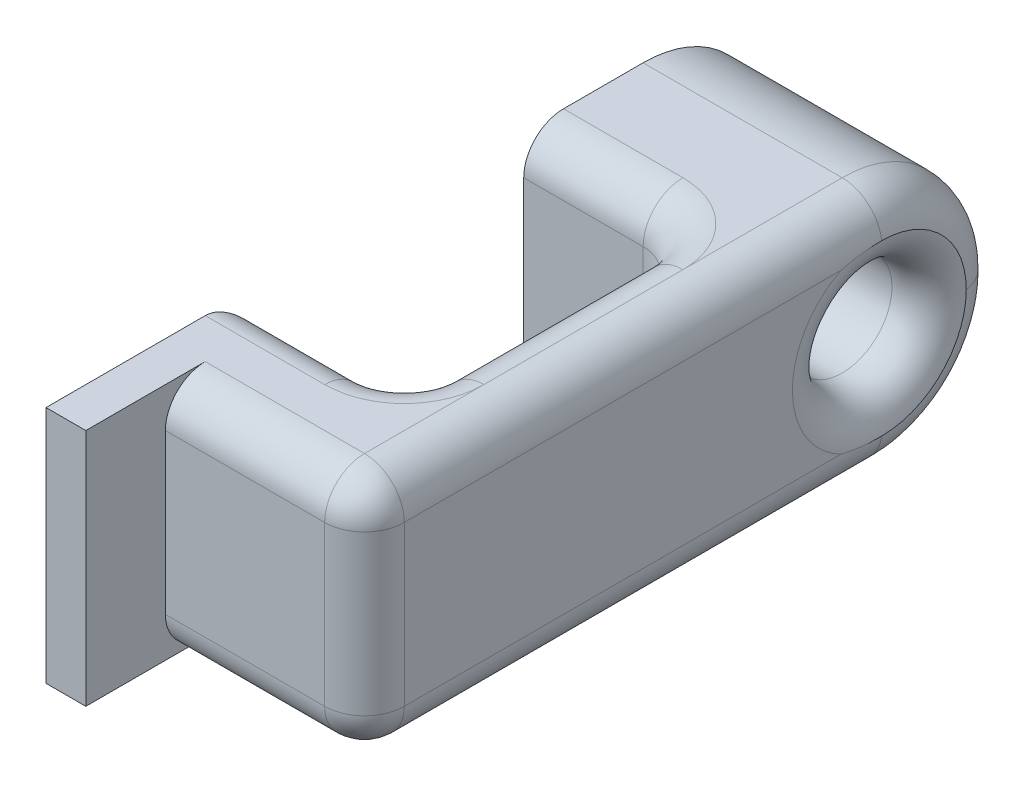
from build123d import *

# Parameters (mm, degrees)
EXTRUDE_1_DEPTH     = 6
FILLET_1_R          = 3
FILLET_2_R          = 1
SKETCH_2_R          = 1.25
CUT_EXTRUDE_1_DEPTH = 20.899748742
FILLET_3_R          = 1


# Some blends are built 0.0001 mm under size
with BuildPart() as part:
    # Эскиз1 → Бобышка-Вытянуть1 (new body)
    with BuildSketch(Plane(origin=(0, 0, 0), x_dir=(1, 0, 0), z_dir=(0, 1, 0))):
        Polygon((0, 0), (0, 5), (4, 5), (4, 12), (0, 12), (0, 18), (6, 18), (6, 2), (1, 2), (1, 0), align=None)
    extrude(amount=EXTRUDE_1_DEPTH)

    # Скругление1
    fillet_1_edges = [part.edges().sort_by_distance(p)[0] for p in [
        (3, 0, -18),
        (3, 6, -18),
    ]]
    fillet(fillet_1_edges, radius=FILLET_1_R - 0.0001)  # a hair under: the kernel refuses the full size

    # Скругление2
    fillet_2_edges = [part.edges().sort_by_distance(p)[0] for p in [
        (3.5, 6, -2),
        (4, 0, -8.5),
        (2, 0, -12),
        (6, 0, -8.50005),
        (3.5, 0, -2),
        (6, 6, -8.50005),
        (0, 3, -5),
        (4, 3, -5),
        (4, 3, -12),
        (6, 3, -2),
        (2, 6, -12),
        (4, 6, -8.5),
        (2, 6, -5),
        (6, 5.121349633, -17.121349633),
        (6, 0.878650367, -17.121349633),
        (2, 0, -5),
    ]]
    fillet(fillet_2_edges, radius=FILLET_2_R - 0.0001)  # a hair under: the kernel refuses the full size

    # Эскиз2 → Вырез-Вытянуть1 (cut, through all)
    with BuildSketch(Plane.ZY):
        with Locations((-15, 3)):
            Circle(SKETCH_2_R)
    extrude(amount=-CUT_EXTRUDE_1_DEPTH, mode=Mode.SUBTRACT)

    # Скругление3
    # the kernel refuses this fillet: 1 mm, written as the material it takes off along each edge
    with BuildSketch(Plane(origin=(6, 3, -15), x_dir=(0, 0, 1), z_dir=(0, -1, 0))) as fillet_3_piece_1:
        with BuildLine():
            CenterArc((1.25 + FILLET_3_R, FILLET_3_R), FILLET_3_R, 180, 90)
            Line((1.25 + FILLET_3_R, 0), (1.25, 0))
            Line((1.25, 0), (1.25, FILLET_3_R))
        make_face()
    revolve(axis=Axis((6, 3, -15), (-1, 0, 0)), mode=Mode.SUBTRACT)


solid = part.part
